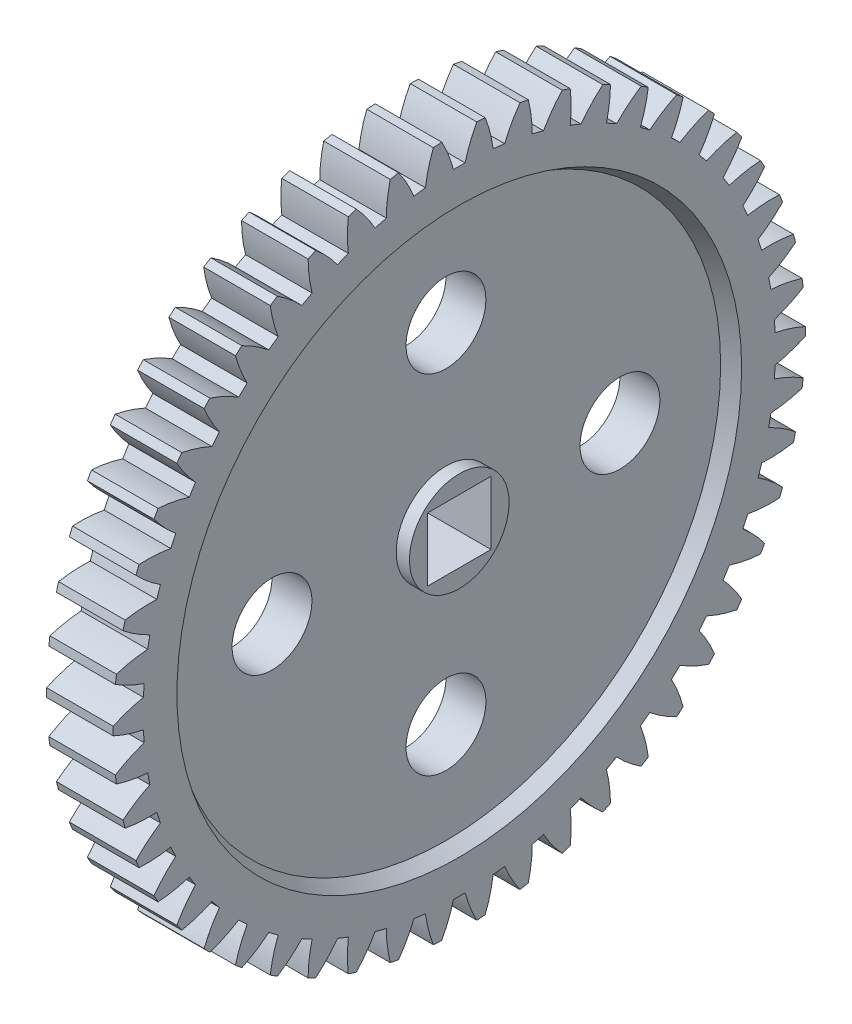
from build123d import *

# Parameters (mm, degrees)
BASPROSKE_W         = 5
BASPROSKE_H         = 26
TOOTHCUT_DEPTH      = 38.107950631
TEETHCUTS_COUNT     = 50
TEETHCUTS_ANGLE     = 352.8
BORSKE_R            = 1.5875
BORE_DEPTH          = 50.0000508
SKETCH1_R           = 21.210972174
CUT_EXTRUDE1_DEPTH  = 1
CUT_EXTRUDE1_TAPER  = 30
BOSS_EXTRUDE1_START = 1
SKETCH2_R           = 3.74131253
SKETCH2_R_2         = 1.5875
BOSS_EXTRUDE1_DEPTH = 1
SKETCH3_R           = 3
CUT_EXTRUDE2_DEPTH  = 37.963064979
CIRPATTERN1_COUNT   = 4
SKETCH5_W           = 4.7625
SKETCH5_H           = 4.7625
CUT_EXTRUDE3_DEPTH  = 38.084608301


with BuildPart() as part:
    # BasProSke → Base-Revolve (revolve)
    with BuildSketch(Plane(origin=(0, 0, 0), x_dir=(1, 0, 0), z_dir=(0, 1, 0))):
        with Locations((2.5, 13)):
            Rectangle(BASPROSKE_W, BASPROSKE_H)
    revolve(axis=Axis((-10, 0, 0), (1, 0, 0)))

    # TooCutSke → ToothCut (cut, through all)
    with BuildSketch(Plane(origin=(0, 0, 0), x_dir=(0, 0, -1), z_dir=(1, 0, 0))):
        with BuildLine():
            ThreePointArc((0.437663408, 23.744966872), (0, 23.749), (-0.437663408, 23.744966872))
            ThreePointArc((-0.437663408, 23.744966872), (-0.815428123, 24.895236298), (-1.329433358, 25.991422664))
            ThreePointArc((-1.329433358, 25.991422664), (0, 26.0254), (1.329433358, 25.991422664))
            ThreePointArc((1.329433358, 25.991422664), (0.815428123, 24.895236298), (0.437663408, 23.744966872))
        make_face()
    toothcut = extrude(amount=TOOTHCUT_DEPTH, mode=Mode.SUBTRACT)

    # TeethCuts: ToothCut ×50 about axis
    teethcuts_axis = Axis((-10, 0, 0), (1, 0, 0))
    for i in range(1, TEETHCUTS_COUNT):
        add(toothcut.rotate(teethcuts_axis, i * TEETHCUTS_ANGLE / (TEETHCUTS_COUNT - 1)), mode=Mode.SUBTRACT)

    # BorSke → Bore (cut, symmetric)
    with BuildSketch(Plane(origin=(0, 0, 0), x_dir=(0, 0, -1), z_dir=(1, 0, 0))):
        Circle(BORSKE_R)
    extrude(amount=BORE_DEPTH, both=True, mode=Mode.SUBTRACT)

    # Sketch1 → Cut-Extrude1 (cut)
    with BuildSketch(Plane(origin=(5, 0, 0), x_dir=(0, 0, -1), z_dir=(1, 0, 0))):
        Circle(SKETCH1_R)
    cut_extrude1 = extrude(amount=-CUT_EXTRUDE1_DEPTH, taper=CUT_EXTRUDE1_TAPER, mode=Mode.SUBTRACT)

    # Sketch2 → Boss-Extrude1 (add)
    with BuildSketch(Plane(origin=(4, 0, 0), x_dir=(0, 0, -1), z_dir=(1, 0, 0)).offset(BOSS_EXTRUDE1_START)):
        Circle(SKETCH2_R)
        Circle(SKETCH2_R_2, mode=Mode.SUBTRACT)
    boss_extrude1 = extrude(amount=-BOSS_EXTRUDE1_DEPTH)

    # Mirror1: Cut-Extrude1, Boss-Extrude1 across plane
    add(cut_extrude1.mirror(Plane(origin=(2.5, 0, 0), x_dir=(0, 0, 1), z_dir=(1, 0, 0))), mode=Mode.SUBTRACT)
    add(boss_extrude1.mirror(Plane(origin=(2.5, 0, 0), x_dir=(0, 0, 1), z_dir=(1, 0, 0))))

    # Sketch3 → Cut-Extrude2 (cut, through all)
    with BuildSketch(Plane(origin=(4, 0, 0), x_dir=(0, 0, -1), z_dir=(1, 0, 0))):
        with Locations((0, 13.0705995)):
            Circle(SKETCH3_R)
    cut_extrude2 = extrude(amount=-CUT_EXTRUDE2_DEPTH, mode=Mode.SUBTRACT)

    # CirPattern1: Cut-Extrude2 ×4 about axis
    cirpattern1_axis = Axis((50.0000508, 0, 0), (-1, 0, 0))
    for i in range(1, CIRPATTERN1_COUNT):
        add(cut_extrude2.rotate(cirpattern1_axis, i * 360 / CIRPATTERN1_COUNT), mode=Mode.SUBTRACT)

    # Sketch5 → Cut-Extrude3 (cut, through all)
    with BuildSketch(Plane(origin=(5, 0, 0), x_dir=(0, 0, -1), z_dir=(1, 0, 0))):
        Rectangle(SKETCH5_W, SKETCH5_H)
    extrude(amount=-CUT_EXTRUDE3_DEPTH, mode=Mode.SUBTRACT)


solid = part.part
